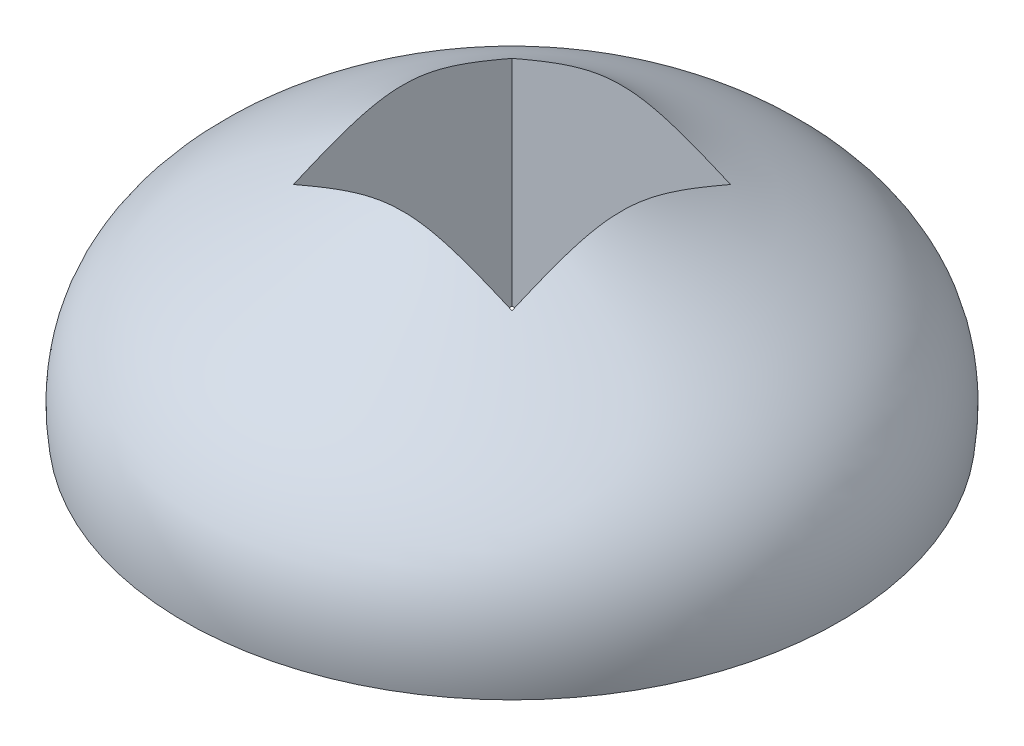
from build123d import *

# Parameters (mm, degrees)
SKETCH2_W          = 0.4
SKETCH2_H          = 0.4
CUT_EXTRUDE1_DEPTH = 1.988973129


with BuildPart() as part:
    # Sketch1 → Revolve1 (revolve)
    with BuildSketch(Plane.XY):
        with BuildLine():
            Line((0, 0), (0, 0.5))
            Line((0, 0.5), (0.15, 0.5))
            add(Edge.make_bspline(
                [(0.15, 0.5), (0.294253128, 0.324669992), (0.64105182, 0.302201542), (0.6, 0)],
                knots=[0, 0, 0, 0, 1, 1, 1, 1], degree=3))
            Line((0.6, 0), (0, 0))
        make_face()
    revolve(axis=Axis((0, 0, 0), (0, 1, 0)))

    # Sketch2 → Cut-Extrude1 (cut, through all)
    with BuildSketch(Plane.XZ):
        Rectangle(SKETCH2_W, SKETCH2_H)
    extrude(amount=-CUT_EXTRUDE1_DEPTH, mode=Mode.SUBTRACT)


solid = part.part
